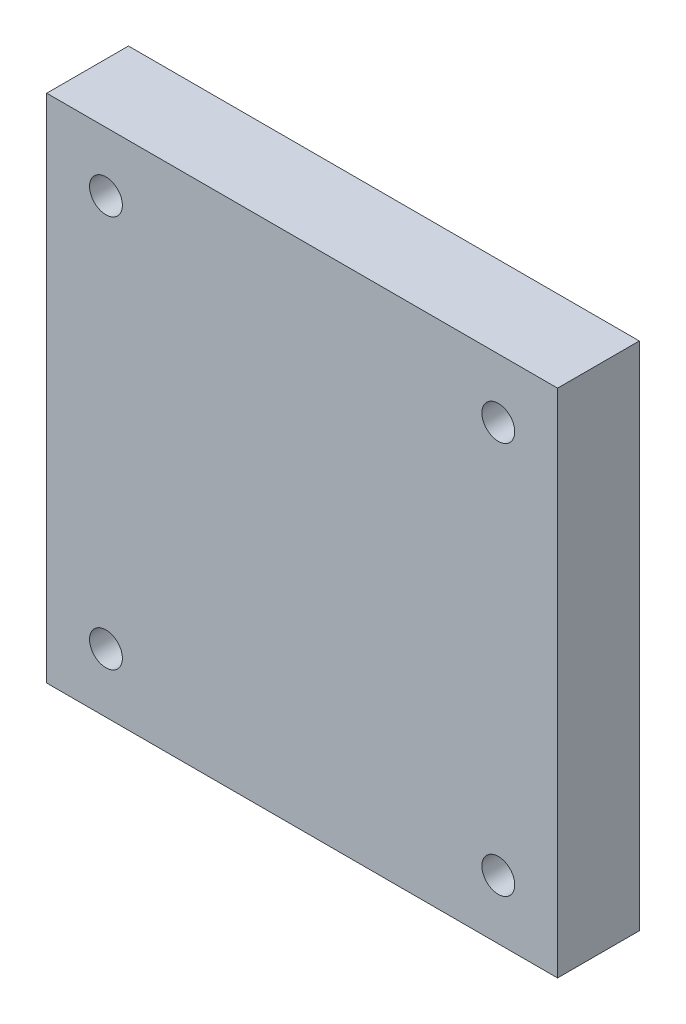
from build123d import *

# Parameters (mm, degrees)
SKETCH1_W                      = 79.375
SKETCH1_H                      = 79.375
BOSS_EXTRUDE1_DEPTH            = 12.7
SKETCH2_R                      = 38.1
CUT_EXTRUDE1_DEPTH             = 8.89
F_7_0_201_DIAMETER_HOLE1_D     = 5.1054
F_7_0_201_DIAMETER_HOLE1_DEPTH = 31.75
F_7_0_201_DIAMETER_HOLE1_TIP   = 1.533816902


with BuildPart() as part:
    # Sketch1 → Boss-Extrude1 (new body)
    with BuildSketch(Plane.XY):
        Rectangle(SKETCH1_W, SKETCH1_H)
    extrude(amount=BOSS_EXTRUDE1_DEPTH)

    # Sketch2 → Cut-Extrude1 (cut)
    with BuildSketch(Plane(origin=(0, 0, 0), x_dir=(-1, 0, 0), z_dir=(0, 0, -1))):
        Circle(SKETCH2_R)
    extrude(amount=-CUT_EXTRUDE1_DEPTH, mode=Mode.SUBTRACT)

    # #7 (0.201) Diameter Hole1
    with Locations(Plane.XY.offset(12.7)):
        with Locations((30.48, 30.48), (-30.48, 30.48), (-30.48, -30.48), (30.48, -30.48)):
            Hole(F_7_0_201_DIAMETER_HOLE1_D / 2, depth=F_7_0_201_DIAMETER_HOLE1_DEPTH)
            with Locations((0, 0, -(F_7_0_201_DIAMETER_HOLE1_DEPTH + F_7_0_201_DIAMETER_HOLE1_TIP / 2))):  # 118° drill point
                Cone(0, F_7_0_201_DIAMETER_HOLE1_D / 2, F_7_0_201_DIAMETER_HOLE1_TIP, mode=Mode.SUBTRACT)


solid = part.part
